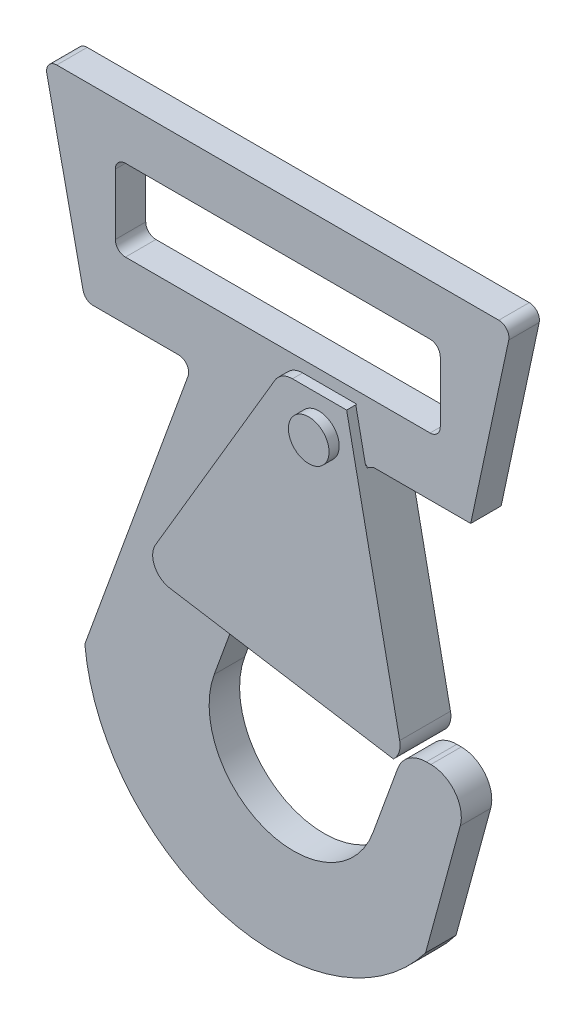
from build123d import *

# Parameters (mm, degrees)
SKETCH1_W           = 60.325
SKETCH1_H           = 3.175
SKETCH1_W_2         = 50.8
SKETCH1_H_2         = 12.7
BOSS_EXTRUDE1_DEPTH = 2.38125
BOSS_EXTRUDE2_DEPTH = 1.5875
SKETCH3_W           = 7.9375
SKETCH3_H           = 44.481099137
BOSS_EXTRUDE3_DEPTH = 1.5875
FILLET1_R           = 3.175
SKETCH4_W           = 5.08
SKETCH4_H           = 7.62
CUT_EXTRUDE1_DEPTH  = 1.5875
SKETCH5_R           = 3.175
BOSS_EXTRUDE4_DEPTH = 1.5875
BOSS_EXTRUDE5_DEPTH = 4.7625
FILLET5_R           = 1.5875
BOSS_EXTRUDE6_DEPTH = 4.7625
FILLET6_R           = 1.5875
FILLET7_R           = 4.7625


with BuildPart() as part:
    # Sketch1 → Boss-Extrude1 (new, symmetric)
    # profile 1 of 2: a face of its own
    with BuildSketch(Plane.XY):
        with Locations((0, 1.5875)):
            Rectangle(SKETCH1_W, SKETCH1_H)
    # profile 2 of 2: a face of its own
    with BuildSketch(Plane.XY):
        with BuildLine():
            Line((30.1625, 0), (-30.1625, 0))
            Line((-30.1625, 0), (-30.1625, -26.543))
            Line((-30.1625, -26.543), (-13.24322167, -26.543))
            Line((-13.24322167, -26.543), (-30.1625, -73.028335164))
            ThreePointArc((-30.1625, -73.028335164), (-8.706855369, -98.7950809), (23.104224388, -88.196728338))
            Line((23.104224388, -88.196728338), (30.1625, -62.282363628))
            Line((30.1625, -62.282363628), (19.885481288, -62.282363628))
            Line((19.885481288, -62.282363628), (14.875106331, -76.048255685))
            ThreePointArc((14.875106331, -76.048255685), (-2.044020786, -83.937774229), (-9.93353933, -67.018647112))
            Line((-9.93353933, -67.018647112), (4.798391431, -26.543))
            Line((4.798391431, -26.543), (30.1625, -26.543))
            Line((30.1625, -26.543), (30.1625, 0))
        make_face()
        with Locations((0, -11.1125)):
            Rectangle(SKETCH1_W_2, SKETCH1_H_2, mode=Mode.SUBTRACT)
    extrude(amount=BOSS_EXTRUDE1_DEPTH, both=True)

    # Sketch6 → Boss-Extrude5 (add)
    with BuildSketch(Plane.XY.offset(2.38125)):
        Polygon((14.958391431, -26.543), (2.192197939, -33.70345777), (4.798391431, -26.543), align=None)
    extrude(amount=-BOSS_EXTRUDE5_DEPTH)

    # Fillet5
    fillet5_edges = [part.edges().sort_by_distance(p)[0] for p in [
        (-25.4, -4.7625, 0),
        (-25.4, -17.4625, 0),
        (25.4, -17.4625, 0),
        (25.4, -4.7625, 0),
    ]]
    fillet(fillet5_edges, radius=FILLET5_R)


with BuildPart() as body_2:
    # Sketch2 → Boss-Extrude2 (new body)
    with BuildSketch(Plane.XY.offset(2.38125)):
        Polygon((2.070915662, -19.294973045), (-19.890264434, -56.479620237), (19.669315265, -62.876274894), (10.767724981, -19.294973045), align=None)
    extrude(amount=BOSS_EXTRUDE2_DEPTH)


with BuildPart() as body_3:
    # Mirror1: mirrored copy
    add(body_2.part.mirror(Plane.XY))


with BuildPart() as body_2_1:
    add(body_2.part)

    add(body_3.part)  # Boss-Extrude3 merges body 3
    # Sketch3 → Boss-Extrude3 (add, along a direction that is not the sketch's normal)
    with BuildSketch(Plane(origin=(6.553281388, 1.338524171, 0), x_dir=(0, 0, -1), z_dir=(0.9797712442921276, 0.2001207357028661, 0))):
        with Locations((0, -43.300054363)):
            Rectangle(SKETCH3_W, SKETCH3_H)
    extrude(amount=BOSS_EXTRUDE3_DEPTH, dir=(1, 0, 0))

    # Fillet1
    # the kernel refuses this fillet: 3.175 mm, written as the material it takes off along each edge
    with BuildSketch(Plane(origin=(-19.890264434, -56.479620237, 9.250541142), x_dir=(0.5085307915682564, 0.8610438049408187, 0), z_dir=(0, 0, -1))) as fillet1_piece_1:
        with BuildLine():
            CenterArc((FILLET1_R * 1.46542250607, FILLET1_R), FILLET1_R, 158.619024622, 111.380975378)
            Line((FILLET1_R * 0.534245587006, FILLET1_R * 1.36456761432), (FILLET1_R * 0.515622048625, FILLET1_R * 1.37185896661))
            Line((FILLET1_R * 0.515622048625, FILLET1_R * 1.37185896661), (-FILLET1_R * 0.0293084501213, -FILLET1_R * 0.02))
            Line((-FILLET1_R * 0.0293084501213, -FILLET1_R * 0.02), (FILLET1_R * 1.46542250607, -FILLET1_R * 0.02))
            Line((FILLET1_R * 1.46542250607, -FILLET1_R * 0.02), (FILLET1_R * 1.46542250607, 0))
        make_face()
    extrude(amount=24.851082284, mode=Mode.SUBTRACT)
    with BuildSketch(Plane(origin=(21.256815265, -62.876274894, -11.590075114), x_dir=(-0.20012073570286557, 0.9797712442921276, 0), z_dir=(0, 0, 1))) as fillet1_piece_2:
        with BuildLine():
            CenterArc((3.048530046, 3.175), FILLET1_R, 210.671448693, 59.328551307)
            Line((0.317691668, 1.55538685), (0.2630749, 1.522994587))
            ThreePointArc((0.2630749, 1.522994587), (0.09663036, 0.790401092), (-0.062215474, 0.012707667))
            Line((-0.062215474, 0.012707667), (0, -0.0635))
            Line((0, -0.0635), (3.048530046, -0.0635))
            Line((3.048530046, -0.0635), (3.048530046, 0))
        make_face()
    extrude(amount=23.180150228, mode=Mode.SUBTRACT)
    with BuildSketch(Plane(origin=(-19.890264434, -56.479620237, -9.250541142), x_dir=(0.5085307915682564, 0.8610438049408187, 0), z_dir=(0, 0, 1))) as fillet1_piece_3:
        with BuildLine():
            CenterArc((FILLET1_R * 1.46542250607, -FILLET1_R), FILLET1_R, 90, 111.380975378)
            Line((FILLET1_R * 0.534245587006, -FILLET1_R * 1.36456761432), (FILLET1_R * 0.515622048625, -FILLET1_R * 1.37185896661))
            Line((FILLET1_R * 0.515622048625, -FILLET1_R * 1.37185896661), (-FILLET1_R * 0.0293084501213, FILLET1_R * 0.02))
            Line((-FILLET1_R * 0.0293084501213, FILLET1_R * 0.02), (FILLET1_R * 1.46542250607, FILLET1_R * 0.02))
            Line((FILLET1_R * 1.46542250607, FILLET1_R * 0.02), (FILLET1_R * 1.46542250607, 0))
        make_face()
    extrude(amount=24.851082284, mode=Mode.SUBTRACT)
    with BuildSketch(Plane(origin=(2.070915662, -19.294973045, 2.149340453), x_dir=(-0.5085307915682565, -0.8610438049408186, 0), z_dir=(0, 0, -1))) as fillet1_piece_4:
        with BuildLine():
            CenterArc((FILLET1_R * 0.570783049145, -FILLET1_R), FILLET1_R, 90, 59.433984029)
            Line((-FILLET1_R * 0.290260755796, -FILLET1_R * 0.491469208432), (-FILLET1_R * 0.307481631894, -FILLET1_R * 0.4812985926))
            Line((-FILLET1_R * 0.307481631894, -FILLET1_R * 0.4812985926), (-FILLET1_R * 0.0114156609829, FILLET1_R * 0.02))
            Line((-FILLET1_R * 0.0114156609829, FILLET1_R * 0.02), (FILLET1_R * 0.570783049145, FILLET1_R * 0.02))
            Line((FILLET1_R * 0.570783049145, FILLET1_R * 0.02), (FILLET1_R * 0.570783049145, 0))
        make_face()
    extrude(amount=10.648680905, mode=Mode.SUBTRACT)
    with BuildSketch(Plane(origin=(2.070915662, -19.294973045, -2.149340453), x_dir=(-0.5085307915682565, -0.8610438049408186, 0), z_dir=(0, 0, 1))) as fillet1_piece_5:
        with BuildLine():
            CenterArc((FILLET1_R * 0.570783049145, FILLET1_R), FILLET1_R, 210.566015971, 59.433984029)
            Line((-FILLET1_R * 0.290260755796, FILLET1_R * 0.491469208432), (-FILLET1_R * 0.307481631894, FILLET1_R * 0.4812985926))
            Line((-FILLET1_R * 0.307481631894, FILLET1_R * 0.4812985926), (-FILLET1_R * 0.0114156609829, -FILLET1_R * 0.02))
            Line((-FILLET1_R * 0.0114156609829, -FILLET1_R * 0.02), (FILLET1_R * 0.570783049145, -FILLET1_R * 0.02))
            Line((FILLET1_R * 0.570783049145, -FILLET1_R * 0.02), (FILLET1_R * 0.570783049145, 0))
        make_face()
    extrude(amount=10.648680905, mode=Mode.SUBTRACT)

    # Sketch4 → Cut-Extrude1 (cut)
    with BuildSketch(Plane(origin=(8.077204698, 1.649789332, 0), x_dir=(0, 0, -1), z_dir=(0.9797712442921276, 0.20012073570286604, 0))):
        with Locations((0, -25.187196462)):
            Rectangle(SKETCH4_W, SKETCH4_H)
    extrude(amount=-CUT_EXTRUDE1_DEPTH, mode=Mode.SUBTRACT)


with BuildPart() as body_3_2:
    # Sketch5 → Boss-Extrude4 (new body)
    with BuildSketch(Plane.XY.offset(3.96875)):
        with Locations((8.012784298, -24.757197764)):
            Circle(SKETCH5_R)
    extrude(amount=BOSS_EXTRUDE4_DEPTH)


with BuildPart() as body_4:
    # Mirror2: mirrored copy
    add(body_3_2.part.mirror(Plane.XY))


with BuildPart() as body_5:
    # Sketch7 → Boss-Extrude6 (new body)
    with BuildSketch(Plane.XY.offset(2.38125)):
        Polygon((-30.1625, -26.543), (-36.5125, 3.175), (-30.1625, 3.175), align=None)
    extrude(amount=-BOSS_EXTRUDE6_DEPTH)


with BuildPart() as body_6:
    # Mirror3: mirrored copy
    add(body_5.part.mirror(Plane(origin=(0, 0, 0), x_dir=(0, 0, 1), z_dir=(1, 0, 0))))


with BuildPart() as part_1:
    add(part.part)

    # Combine1: union body 6, body 5
    add(body_6.part)
    add(body_5.part)

    # Fillet6
    fillet6_edges = [part_1.edges().sort_by_distance(p)[0] for p in [
        (-30.1625, -26.543, 0),
        (-36.5125, 3.175, 0),
        (-13.24322167, -26.543, 0),
        (36.5125, 3.175, 0),
    ]]
    fillet(fillet6_edges, radius=FILLET6_R)

    # Fillet7
    fillet7_edges = [part_1.edges().sort_by_distance(p)[0] for p in [
        (19.885481288, -62.282363628, 0),
        (30.1625, -62.282363628, 0),
    ]]
    fillet(fillet7_edges, radius=FILLET7_R)


solid = Compound([body_2_1.part, body_3_2.part, body_4.part, part_1.part])
